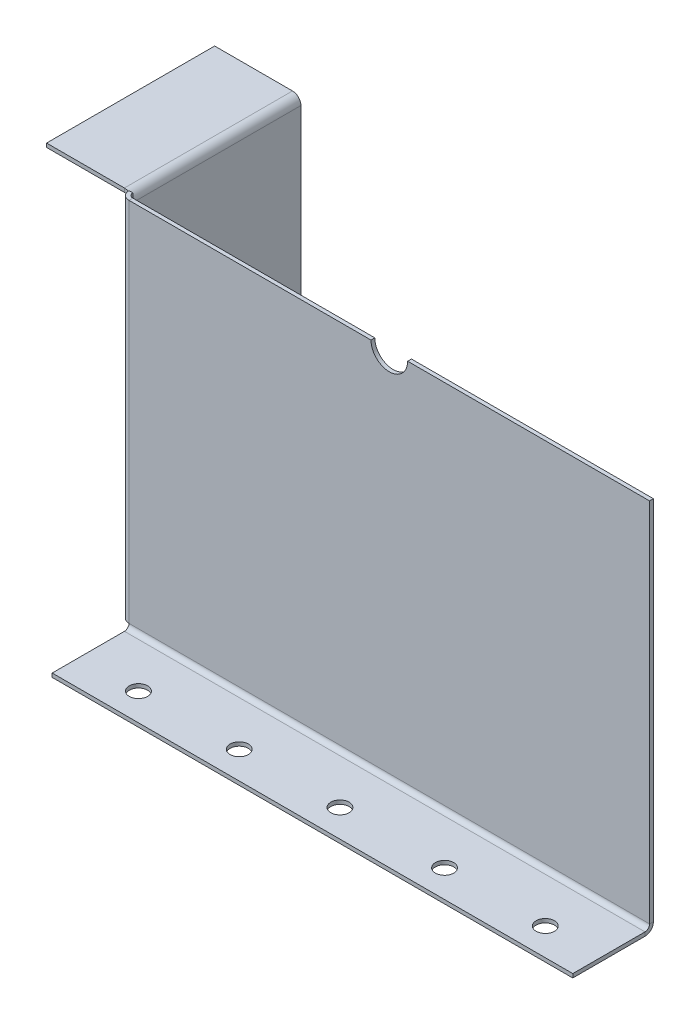
from build123d import *

# Parameters (mm, degrees)
BASE_FLANGE1_DEPTH           = 2.65684
SKETCHED_BEND3_DEPTH         = 360.91368
SKETCHED_BEND3_2_DEPTH       = 360.91368
SKETCH10_R                   = 6.35
CUT_EXTRUDE2_DEPTH           = 2.65684
EDGE_FLANGE5_DEPTH           = 254
EDGE_FLANGE6_STRIP_W         = 16.97736
EDGE_FLANGE6_STRIP_H         = 2.65684
EDGE_FLANGE6_STRIP_CUT_DEPTH = 116.5225
EDGE_FLANGE6_DEPTH           = 116.5225
SKETCH36_R                   = 6.35
CUT_EXTRUDE4_DEPTH           = 2.65684


# Read off the part's stored shape, not the designer's step: Sketched Bend3
# Sheet-metal steps are written as plain solids
with BuildPart() as part:
    # Sketch1 → Base-Flange1 (new body)
    with BuildSketch(Plane.XY):
        with BuildLine():
            Line((0, 0), (0, 254))
            Line((0, 254), (167.75684, 254))
            ThreePointArc((167.75684, 254), (180.45684, 241.3), (193.15684, 254))
            Line((193.15684, 254), (360.91368, 254))
            Line((360.91368, 254), (360.91368, 0))
            Line((360.91368, 0), (360.91368, -57.15))
            Line((360.91368, -57.15), (0, -57.15))
            Line((0, -57.15), (0, 0))
        make_face()
    extrude(amount=-BASE_FLANGE1_DEPTH)

    # Sketched Bend3 outline → Sketched Bend3 (cut)
    with BuildSketch(Plane.YZ):
        with BuildLine():
            ThreePointArc((0, -2.65684), (-2.783367186, -1.949765838), (-4.891802611, 0))
            Line((-4.891802611, 0), (-57.15, 0))
            Line((-57.15, 0), (-57.15, -2.65684))
            Line((-57.15, -2.65684), (0, -2.65684))
        make_face()
    extrude(amount=SKETCHED_BEND3_DEPTH, mode=Mode.SUBTRACT)

    # Sketched Bend3 2 outline → Sketched Bend3 2 (add)
    with BuildSketch(Plane.YZ):
        with BuildLine():
            ThreePointArc((0, 0), (-2.24506403, 0.92993597), (-3.175, 3.175))
            Line((-3.175, 3.175), (-3.175, 53.251044406))
            Line((-3.175, 53.251044406), (-5.83184, 53.251044406))
            Line((-5.83184, 53.251044406), (-5.83184, 3.175))
            ThreePointArc((-5.83184, 3.175), (-5.591894488, 1.519381136), (-4.891802611, 0))
            Line((-4.891802611, 0), (0, 0))
        make_face()
    extrude(amount=SKETCHED_BEND3_2_DEPTH)

    # Sketch10 → Cut-Extrude2 (cut)
    with BuildSketch(Plane(origin=(0, -3.175, 0), x_dir=(1, 0, 0), z_dir=(0, 1, 0))):
        with Locations(Location((322.81368, -34.201044406, 0), (0, 0, 270))):
            Circle(SKETCH10_R)
        with Locations(Location((252.96368, -34.201044406, 0), (0, 0, 270))):
            Circle(SKETCH10_R)
        with Locations(Location((40.75684, -34.201044406, 0), (0, 0, 270))):
            Circle(SKETCH10_R)
        with Locations(Location((110.60684, -34.201044406, 0), (0, 0, 270))):
            Circle(SKETCH10_R)
        with Locations(Location((180.45684, -34.201044406, 0), (0, 0, 270))):
            Circle(SKETCH10_R)
    extrude(amount=-CUT_EXTRUDE2_DEPTH, mode=Mode.SUBTRACT)

    # Edge-Flange5 section (across the edge) → Edge-Flange5 (add)
    with BuildSketch(Plane(origin=(-3.175, 0, -2.65684), x_dir=(1, 0, 0), z_dir=(0, 1, 0))):
        with BuildLine():
            Line((-2.65684, 3.175), (-2.65684, 119.6975))
            Line((-2.65684, 119.6975), (0, 119.6975))
            Line((0, 119.6975), (0, 3.175))
            ThreePointArc((0, 3.175), (0.92993597, 0.92993597), (3.175, 0))
            Line((3.175, 0), (3.175, -2.65684))
            ThreePointArc((3.175, -2.65684), (-0.948733611, -0.948733611), (-2.65684, 3.175))
        make_face()
    extrude(amount=EDGE_FLANGE5_DEPTH)

    # Edge-Flange6 strip (across the edge) → Edge-Flange6 strip cut (cut)
    with BuildSketch(Plane(origin=(-5.83184, 254, -5.83184), x_dir=(0, -1, 0), z_dir=(0, 0, -1))):
        with Locations((-2.65684, -1.32842)):
            Rectangle(EDGE_FLANGE6_STRIP_W, EDGE_FLANGE6_STRIP_H)
    extrude(amount=EDGE_FLANGE6_STRIP_CUT_DEPTH, mode=Mode.SUBTRACT)

    # Edge-Flange6 section (across the edge) → Edge-Flange6 (add)
    with BuildSketch(Plane(origin=(-5.83184, 254, -5.83184), x_dir=(0, -1, 0), z_dir=(0, 0, -1))):
        with BuildLine():
            Line((0, 3.175), (0, 57.15))
            Line((0, 57.15), (2.65684, 57.15))
            Line((2.65684, 57.15), (2.65684, 3.175))
            ThreePointArc((2.65684, 3.175), (3.58677597, 0.92993597), (5.83184, 0))
            Line((5.83184, 0), (5.83184, -2.65684))
            ThreePointArc((5.83184, -2.65684), (1.708106389, -0.948733611), (0, 3.175))
        make_face()
    extrude(amount=EDGE_FLANGE6_DEPTH)

    # Sketch36 → Cut-Extrude4 (cut)
    with BuildSketch(Plane.ZY.offset(5.83184)):
        with Locations((-35.989590501, 43.324159587)):
            Circle(SKETCH36_R)
        with Locations((-92.124928486, 45.966665125)):
            Circle(SKETCH36_R)
    extrude(amount=-CUT_EXTRUDE4_DEPTH, mode=Mode.SUBTRACT)


solid = part.part
